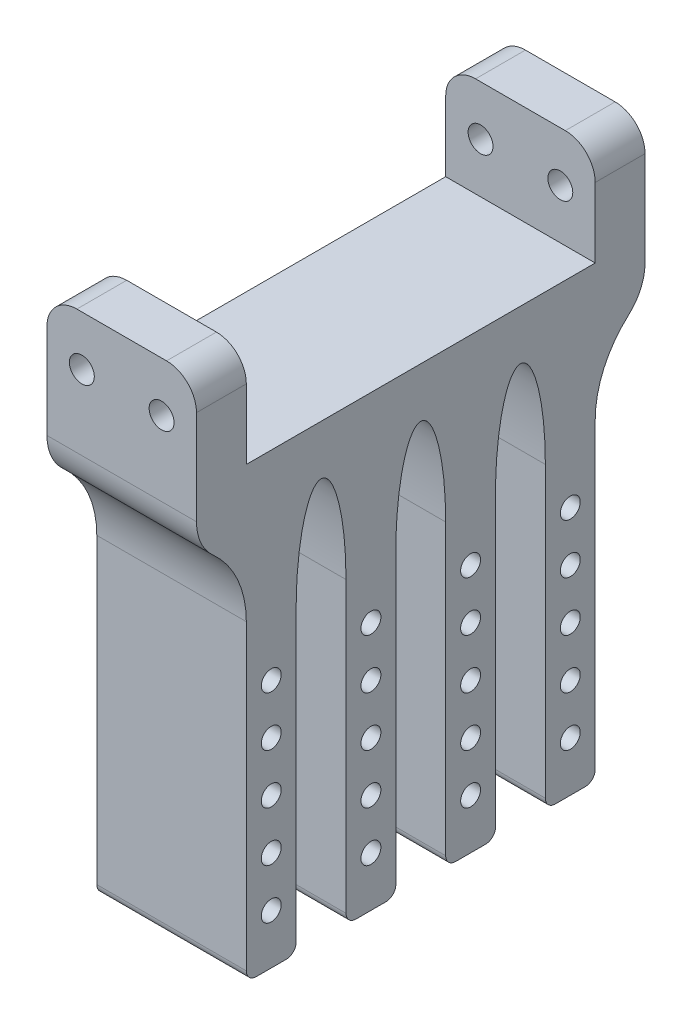
from build123d import *

# Parameters (mm, degrees)
SKETCH_3_W               = 45
SKETCH_3_H               = 5
EXTRUDE_2_DEPTH          = 15
SKETCH_4_W               = 15
SKETCH_4_H               = 5
EXTRUDE_3_DEPTH          = 10
SKETCH_6_R               = 1.25
CUT_EXTRUDE_3_DEPTH      = 50
FILLET_3_R               = 3
SKETCH_7_W               = 15
SKETCH_7_H               = 5
EXTRUDE_4_DEPTH          = 40
FILLET_4_R               = 10
FILLET_5_R               = 5
FILLET_6_R               = 1
FILLET_7_SIZE            = 10
FILLET_7_SIZE_2          = 2.5
SKETCH_8_R               = 1
CUT_EXTRUDE_4_DEPTH      = 40
MIRROR_2_COPY_1_SKETCH_R = 1
MIRROR_2_COPY_1_DEPTH    = 40
MIRROR_2_COPY_2_SKETCH_R = 1
MIRROR_2_COPY_2_DEPTH    = 40
MIRROR_2_COPY_3_SKETCH_R = 1
MIRROR_2_COPY_3_DEPTH    = 40


with BuildPart() as part:
    # 草图3 → 凸台-拉伸2 (new body)
    with BuildSketch(Plane(origin=(0, 0, 0), x_dir=(0, 0, -1), z_dir=(1, 0, 0))):
        with Locations((22.5, 2.5)):
            Rectangle(SKETCH_3_W, SKETCH_3_H)
    extrude(amount=EXTRUDE_2_DEPTH)

    # 草图4 → 凸台-拉伸3 (add)
    with BuildSketch(Plane(origin=(0, 5, 0), x_dir=(1, 0, 0), z_dir=(0, 1, 0))):
        with Locations((7.5, 42.5)):
            Rectangle(SKETCH_4_W, SKETCH_4_H)
        with Locations((7.5, 2.5)):
            Rectangle(SKETCH_4_W, SKETCH_4_H)
    extrude(amount=EXTRUDE_3_DEPTH)

    # 草图6 → 切除-拉伸3 (cut)
    with BuildSketch(Plane.XY):
        with Locations((3.5, 10)):
            Circle(SKETCH_6_R)
        with Locations((11.5, 10)):
            Circle(SKETCH_6_R)
    extrude(amount=-CUT_EXTRUDE_3_DEPTH, mode=Mode.SUBTRACT)

    # 圆角3
    fillet_3_edges = [part.edges().sort_by_distance(p)[0] for p in [
        (0, 15, -42.5),
        (15, 15, -42.5),
        (0, 15, -2.5),
        (15, 15, -2.5),
    ]]
    fillet(fillet_3_edges, radius=FILLET_3_R)

    # 草图7 → 凸台-拉伸4 (add)
    with BuildSketch(Plane(origin=(0, 0, 0), x_dir=(-1, 0, 0), z_dir=(0, -1, 0))):
        with Locations((-7.5, 27.5)):
            Rectangle(SKETCH_7_W, SKETCH_7_H)
        with Locations((-7.5, 17.5)):
            Rectangle(SKETCH_7_W, SKETCH_7_H)
        with Locations((-7.5, 37.5)):
            Rectangle(SKETCH_7_W, SKETCH_7_H)
        with Locations((-7.5, 7.5)):
            Rectangle(SKETCH_7_W, SKETCH_7_H)
    extrude(amount=EXTRUDE_4_DEPTH)

    # 圆角4
    # the kernel refuses this fillet: 10 mm, written as the material it adds along each edge
    with BuildSketch(Plane(origin=(0, 0, -5), x_dir=(0, 0, 1), z_dir=(1, 0, 0)), Plane(origin=(15, 0, -40), x_dir=(0, 0, -1), z_dir=(-1, 0, 0))) as fillet_4_piece_1:
        with BuildLine():
            CenterArc((10, 8.660254038), FILLET_4_R, 180, 60)
            Line((0, 8.660254038), (-0.2, 8.660254038))
            Line((-0.2, 8.660254038), (-0.2, 0))
            Line((-0.2, 0), (0, -0.2))
            ThreePointArc((0, -0.2), (2.5, -0.2), (4.9, -0.173205081))
            Line((4.9, -0.173205081), (5, 0))
        make_face()
    extrude(amount=15)

    # 圆角5
    fillet_5_edges = [part.edges().sort_by_distance(p)[0] for p in [
        (7.5, 0, -45),
        (7.5, 0, 0),
    ]]
    fillet(fillet_5_edges, radius=FILLET_5_R)

    # 圆角6
    fillet_6_edges = [part.edges().sort_by_distance(p)[0] for p in [
        (7.5, -40, -15),
        (7.5, -40, -20),
        (7.5, -40, -35),
        (7.5, -40, -40),
        (7.5, -40, -5),
        (7.5, -40, -10),
        (7.5, -40, -25),
        (7.5, -40, -30),
    ]]
    fillet(fillet_6_edges, radius=FILLET_6_R)

    # 圆角7
    # an asymmetric fillet: 10, 2.5 mm, written as the material it adds along each edge
    with BuildSketch(Plane(origin=(15, 0, -10), x_dir=(0, -1, 0), z_dir=(-1, 0, 0)), Plane(origin=(15, 0, -20), x_dir=(0, -1, 0), z_dir=(-1, 0, 0)), Plane(origin=(15, 0, -30), x_dir=(0, -1, 0), z_dir=(-1, 0, 0)), Plane(origin=(0, 0, -35), x_dir=(0, -1, 0), z_dir=(1, 0, 0))) as fillet_7_piece_1:
        with BuildLine():
            Bezier((FILLET_7_SIZE, 0), (0, 0), (0, -FILLET_7_SIZE_2), weights=[1, 0.707106781, 1])
            Line((0, -FILLET_7_SIZE_2), (0, 0))
            Line((0, 0), (FILLET_7_SIZE, 0))
        make_face()
    extrude(amount=15)
    with BuildSketch(Plane(origin=(0, 0, -15), x_dir=(0, 0, 1), z_dir=(1, 0, 0)), Plane(origin=(0, 0, -25), x_dir=(0, 0, 1), z_dir=(1, 0, 0))) as fillet_7_piece_2:
        with BuildLine():
            Bezier((FILLET_7_SIZE_2, 0), (0, 0), (0, FILLET_7_SIZE), weights=[1, 0.707106781, 1])
            Line((0, FILLET_7_SIZE), (0, 0))
            Line((0, 0), (FILLET_7_SIZE_2, 0))
        make_face()
    extrude(amount=15)

    # 草图8 → 切除-拉伸4 (cut)
    with BuildSketch(Plane.ZY):
        with Locations((-27.5, -15)):
            Circle(SKETCH_8_R)
        with Locations((-27.5, -20)):
            Circle(SKETCH_8_R)
        with Locations((-27.5, -25)):
            Circle(SKETCH_8_R)
        with Locations((-27.5, -30)):
            Circle(SKETCH_8_R)
        with Locations((-27.5, -35)):
            Circle(SKETCH_8_R)
    cut_extrude_4 = extrude(amount=-CUT_EXTRUDE_4_DEPTH, mode=Mode.SUBTRACT)

    # 镜向1: 切除-拉伸4 across plane
    add(cut_extrude_4.mirror(Plane(origin=(0, 0, -32.5), x_dir=(1, 0, 0), z_dir=(0, 0, -1))), mode=Mode.SUBTRACT)

    # 镜向1 at the second plane: 切除-拉伸4 across plane
    add(cut_extrude_4.mirror(Plane(origin=(0, 0, -22.5), x_dir=(1, 0, 0), z_dir=(0, 0, -1))), mode=Mode.SUBTRACT)

    # 镜向2 copy 1 sketch → 镜向2 copy 1 (cut)
    with BuildSketch(Plane(origin=(0, 0, 20), x_dir=(0, 0, 1), z_dir=(-1, 0, 0))):
        with Locations((-27.5, -15)):
            Circle(MIRROR_2_COPY_1_SKETCH_R)
        with Locations((-27.5, -20)):
            Circle(MIRROR_2_COPY_1_SKETCH_R)
        with Locations((-27.5, -25)):
            Circle(MIRROR_2_COPY_1_SKETCH_R)
        with Locations((-27.5, -30)):
            Circle(MIRROR_2_COPY_1_SKETCH_R)
        with Locations((-27.5, -35)):
            Circle(MIRROR_2_COPY_1_SKETCH_R)
    extrude(amount=-MIRROR_2_COPY_1_DEPTH, mode=Mode.SUBTRACT)

    # 镜向2 copy 2 sketch → 镜向2 copy 2 (cut)
    with BuildSketch(Plane.ZY):
        with Locations((-27.5, -15)):
            Circle(MIRROR_2_COPY_2_SKETCH_R)
        with Locations((-27.5, -20)):
            Circle(MIRROR_2_COPY_2_SKETCH_R)
        with Locations((-27.5, -25)):
            Circle(MIRROR_2_COPY_2_SKETCH_R)
        with Locations((-27.5, -30)):
            Circle(MIRROR_2_COPY_2_SKETCH_R)
        with Locations((-27.5, -35)):
            Circle(MIRROR_2_COPY_2_SKETCH_R)
    extrude(amount=-MIRROR_2_COPY_2_DEPTH, mode=Mode.SUBTRACT)

    # 镜向2 copy 3 sketch → 镜向2 copy 3 (cut)
    with BuildSketch(Plane(origin=(0, 0, -45), x_dir=(0, 0, -1), z_dir=(-1, 0, 0))):
        with Locations((-27.5, 15)):
            Circle(MIRROR_2_COPY_3_SKETCH_R)
        with Locations((-27.5, 20)):
            Circle(MIRROR_2_COPY_3_SKETCH_R)
        with Locations((-27.5, 25)):
            Circle(MIRROR_2_COPY_3_SKETCH_R)
        with Locations((-27.5, 30)):
            Circle(MIRROR_2_COPY_3_SKETCH_R)
        with Locations((-27.5, 35)):
            Circle(MIRROR_2_COPY_3_SKETCH_R)
    extrude(amount=-MIRROR_2_COPY_3_DEPTH, mode=Mode.SUBTRACT)


solid = part.part
